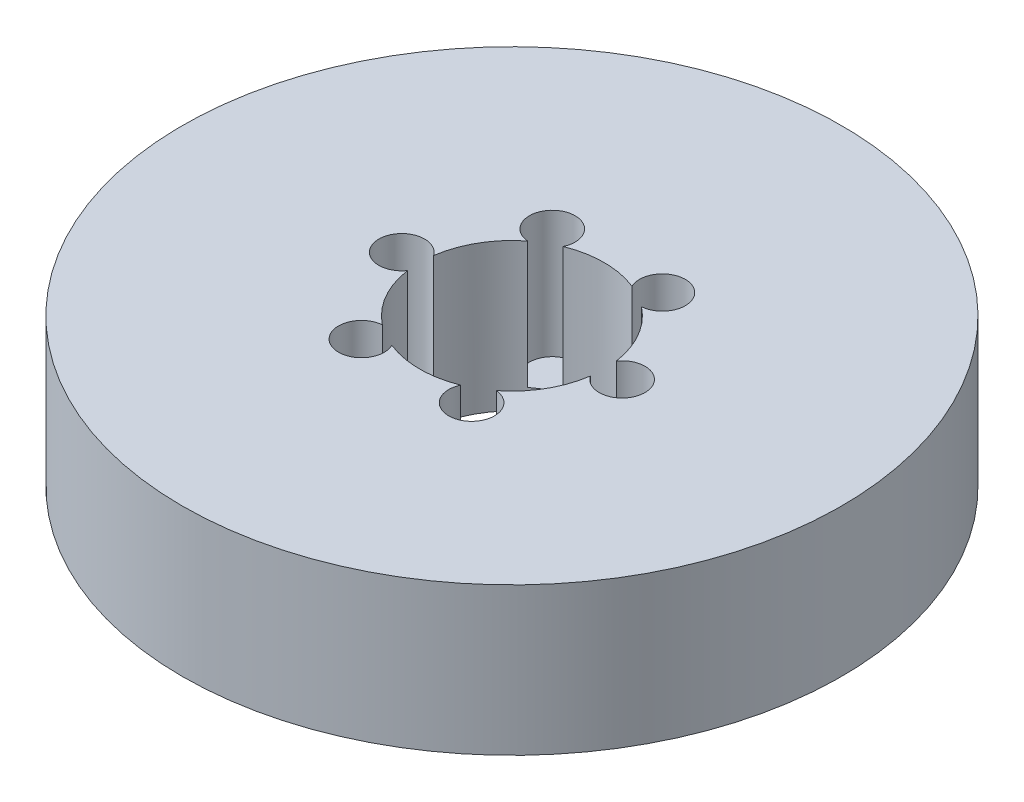
from build123d import *

# Parameters (mm, degrees)
SKETCH1_R           = 62.5
BOSS_EXTRUDE1_DEPTH = 28
SKETCH2_R           = 17.5
CUT_EXTRUDE1_DEPTH  = 93.717312299
SKETCH3_R           = 4.337983505
CUT_EXTRUDE2_DEPTH  = 24.050308735
CIRPATTERN1_COUNT   = 6


with BuildPart() as part:
    # Sketch1 → Boss-Extrude1 (new body)
    with BuildSketch(Plane(origin=(0, 0, 0), x_dir=(1, 0, 0), z_dir=(0, 1, 0))):
        Circle(SKETCH1_R)
    extrude(amount=BOSS_EXTRUDE1_DEPTH)

    # Sketch2 → Cut-Extrude1 (cut, through all)
    with BuildSketch(Plane(origin=(0, 0, 0), x_dir=(1, 0, 0), z_dir=(0, 1, 0))):
        Circle(SKETCH2_R)
    extrude(amount=CUT_EXTRUDE1_DEPTH, mode=Mode.SUBTRACT)

    # Sketch3 → Cut-Extrude2 (cut)
    with BuildSketch(Plane(origin=(0, 28, 0), x_dir=(1, 0, 0), z_dir=(0, 1, 0))):
        with Locations((-20.892691055, 0)):
            Circle(SKETCH3_R)
    cut_extrude2 = extrude(amount=-CUT_EXTRUDE2_DEPTH, mode=Mode.SUBTRACT)

    # CirPattern1: Cut-Extrude2 ×6 about axis
    cirpattern1_axis = Axis((0, 0, 0), (0, 1, 0))
    for i in range(1, CIRPATTERN1_COUNT):
        add(cut_extrude2.rotate(cirpattern1_axis, i * 360 / CIRPATTERN1_COUNT), mode=Mode.SUBTRACT)


solid = part.part
